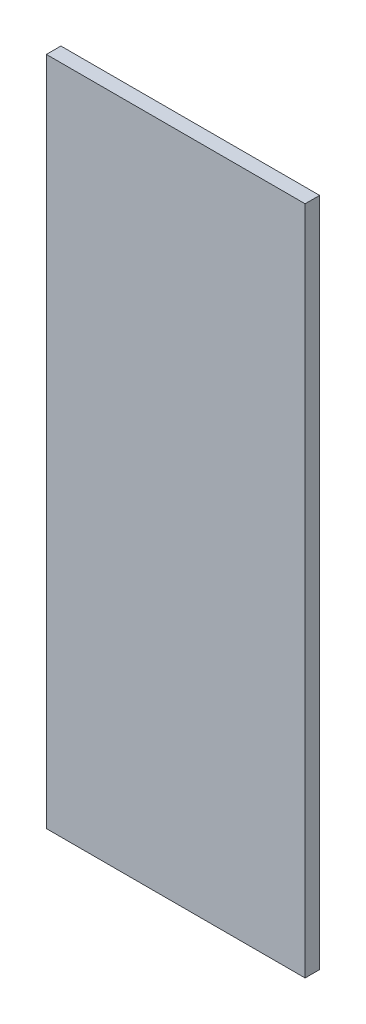
from build123d import *

# Parameters (mm, degrees)
SKETCH1_W           = 56.55
SKETCH1_H           = 146.55
BOSS_EXTRUDE1_DEPTH = 3.175


with BuildPart() as part:
    # Sketch1 → Boss-Extrude1 (new body)
    with BuildSketch(Plane.XY):
        Rectangle(SKETCH1_W, SKETCH1_H)
    extrude(amount=BOSS_EXTRUDE1_DEPTH)


solid = part.part
